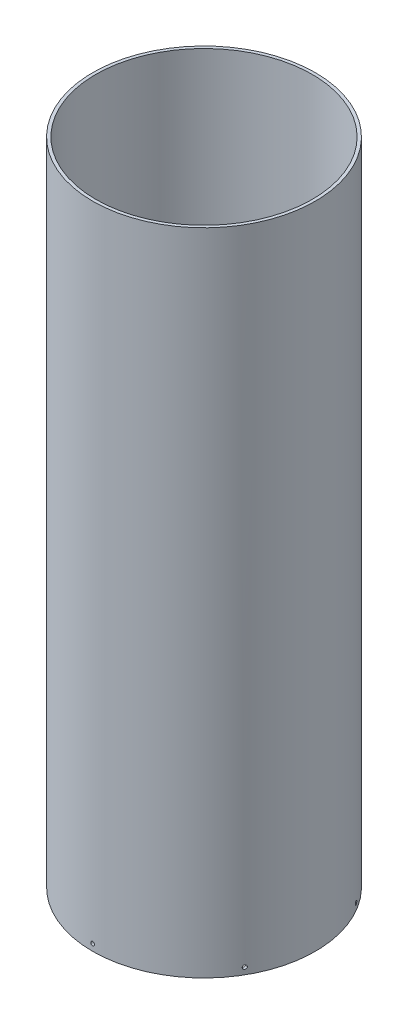
from build123d import *

# Parameters (mm, degrees)
SKETCH1_R           = 78.359
SKETCH1_R_2         = 76.2
BOSS_EXTRUDE1_DEPTH = 457.2
SKETCH2_R           = 1.35255
CUT_EXTRUDE1_DEPTH  = 471.438206104
CIRPATTERN1_COUNT   = 6


with BuildPart() as part:
    # Sketch1 → Boss-Extrude1 (new body)
    with BuildSketch(Plane(origin=(0, 0, 0), x_dir=(1, 0, 0), z_dir=(0, 1, 0))):
        Circle(SKETCH1_R)
        Circle(SKETCH1_R_2, mode=Mode.SUBTRACT)
    extrude(amount=BOSS_EXTRUDE1_DEPTH)

    # Sketch2 → Cut-Extrude1 (cut, through all)
    with BuildSketch(Plane.XY):
        with Locations((0, 4.7625)):
            Circle(SKETCH2_R)
    cut_extrude1 = extrude(amount=-CUT_EXTRUDE1_DEPTH, mode=Mode.SUBTRACT)

    # CirPattern1: Cut-Extrude1 ×6 about axis
    cirpattern1_axis = Axis((0, 457.2, 0), (0, -1, 0))
    for i in range(1, CIRPATTERN1_COUNT):
        add(cut_extrude1.rotate(cirpattern1_axis, i * 360 / CIRPATTERN1_COUNT), mode=Mode.SUBTRACT)


solid = part.part
